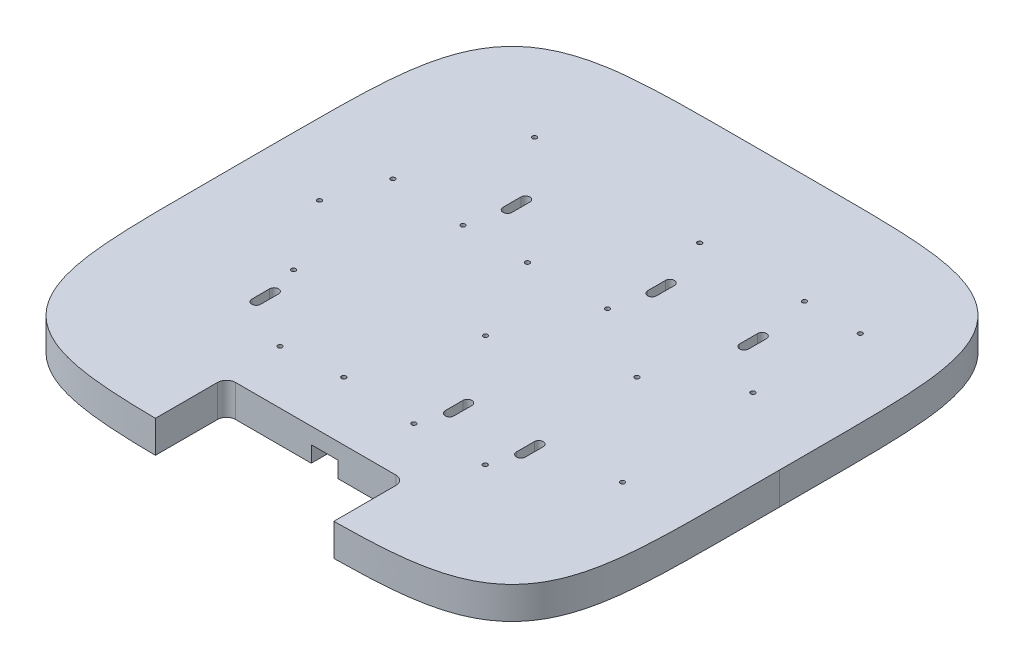
from build123d import *

# Parameters (mm, degrees)
EXTRUDE_1771_DEPTH     = 36
SKETCH_1845_R          = 2.5
CUT_EXTRUDE_1872_DEPTH = 426.788610973
CUT_EXTRUDE_2565_DEPTH = 426.788610973
CUT_EXTRUDE_START      = 18
CUT_EXTRUDE_3162_DEPTH = 18


with BuildPart() as part:
    # Sketch 1764 → Extrude 1771 (new body)
    with BuildSketch(Plane(origin=(0, 0, 0), x_dir=(1, 0, 0), z_dir=(0, 1, 0))):
        with BuildLine():
            Line((-90, -220), (90, -220))
            ThreePointArc((90, -220), (97.071067812, -222.928932188), (100, -230))
            Line((100, -230), (100, -299.752699511))
            add(Edge.make_bspline(
                [(299.999950922, 0), (299.999805192, -8.694402544), (299.999667529, -21.736035588), (300.001217481, -36.951333186), (299.99065116, -54.340218257), (299.962336101, -71.728961342), (299.875758768, -93.46518347), (299.602883242, -117.241979096), (298.679376501, -143.050585558), (297.196692477, -163.287197651), (295.58622598, -177.957343933), (293.488823304, -191.500890473), (291.134108446, -202.858139947), (288.408912089, -213.045142513), (285.410357183, -222.048680325), (282.27571239, -229.881370012), (278.620871904, -237.486995605), (274.403235391, -244.797456487), (269.595972653, -251.736262834), (264.19540074, -258.225391709), (258.225413369, -264.195385619), (251.736290224, -269.595963991), (244.797488667, -274.403233136), (237.487031812, -278.620875987), (229.881409486, -282.275722517), (222.048722342, -285.410372899), (213.045186685, -288.408933496), (202.858185777, -291.134135293), (191.500937546, -293.488855196), (177.957391812, -295.586262487), (163.287246128, -297.196732944), (143.050634387, -298.679420744), (124.850055244, -299.330692316), (110.859628638, -299.611028911), (101.083006334, -299.739273014), (100, -299.752699511)],
                knots=[0, 0, 0, 0, 0, 0.064453125, 0.096679688, 0.112792969, 0.12890625, 0.193359375, 0.2578125, 0.2890625, 0.3203125, 0.34375, 0.3671875, 0.390625, 0.40625, 0.421875, 0.4375, 0.453125, 0.46875, 0.484375, 0.5, 0.515625, 0.53125, 0.546875, 0.5625, 0.578125, 0.59375, 0.609375, 0.6328125, 0.65625, 0.6796875, 0.7109375, 0.7421875, 0.806640625, 0.814669783, 0.814669783, 0.814669783, 0.814669783, 0.814669783], degree=4))
            add(Edge.make_bspline(
                [(299.999950922, 0), (299.999803769, 8.694402544), (299.999663973, 21.736035588), (300.001211436, 36.951333186), (299.99064227, 54.340218255), (299.962324366, 71.728961336), (299.875743478, 93.465183449), (299.602864063, 117.241979031), (298.679353099, 143.050585342), (297.196665764, 163.287197192), (295.586196868, 177.957343211), (293.488791976, 191.500889408), (291.13407526, 202.858138497), (288.408877236, 213.045140617), (285.410320857, 222.048677938), (282.275674783, 229.881367112), (278.620833053, 237.486992108), (274.403195344, 244.7974523), (269.595931471, 251.73625786), (264.195358497, 258.225385851), (258.225370149, 264.195378785), (251.73624612, 269.595956096), (244.797443777, 274.403224105), (237.486986232, 278.620865761), (229.881363308, 282.275711046), (222.048675651, 285.410360147), (213.045139504, 288.40891927), (202.85813815, 291.134119401), (191.500889533, 293.488837446), (177.957343457, 295.586242522), (163.287197509, 297.196710579), (143.050585526, 298.679395068), (117.241979065, 299.602900558), (93.465183554, 299.875773298), (71.728961216, 299.962347549), (54.340218396, 299.990659976), (36.951333084, 300.001223545), (21.73603502, 299.999670958), (8.694402191, 299.999806536), (0, 299.999950922)],
                knots=[0, 0, 0, 0, 0, 0.064453125, 0.096679688, 0.112792969, 0.12890625, 0.193359375, 0.2578125, 0.2890625, 0.3203125, 0.34375, 0.3671875, 0.390625, 0.40625, 0.421875, 0.4375, 0.453125, 0.46875, 0.484375, 0.5, 0.515625, 0.53125, 0.546875, 0.5625, 0.578125, 0.59375, 0.609375, 0.6328125, 0.65625, 0.6796875, 0.7109375, 0.7421875, 0.806640625, 0.87109375, 0.887207031, 0.903320312, 0.935546875, 1, 1, 1, 1, 1], degree=4))
            add(Edge.make_bspline(
                [(-299.999950922, 0), (-299.999803769, 8.694402544), (-299.999663973, 21.736035588), (-300.001211436, 36.951333186), (-299.99064227, 54.340218255), (-299.962324366, 71.728961336), (-299.875743478, 93.465183449), (-299.602864063, 117.241979031), (-298.679353099, 143.050585342), (-297.196665764, 163.287197192), (-295.586196868, 177.957343211), (-293.488791976, 191.500889408), (-291.13407526, 202.858138497), (-288.408877236, 213.045140617), (-285.410320857, 222.048677938), (-282.275674783, 229.881367112), (-278.620833053, 237.486992108), (-274.403195344, 244.7974523), (-269.595931471, 251.73625786), (-264.195358497, 258.225385851), (-258.225370149, 264.195378785), (-251.73624612, 269.595956096), (-244.797443777, 274.403224105), (-237.486986232, 278.620865761), (-229.881363308, 282.275711046), (-222.048675651, 285.410360147), (-213.045139504, 288.40891927), (-202.85813815, 291.134119401), (-191.500889533, 293.488837446), (-177.957343457, 295.586242522), (-163.287197509, 297.196710579), (-143.050585526, 298.679395068), (-117.241979065, 299.602900558), (-93.465183554, 299.875773298), (-71.728961216, 299.962347549), (-54.340218396, 299.990659976), (-36.951333084, 300.001223545), (-21.73603502, 299.999670958), (-8.694402191, 299.999806536), (0, 299.999950922)],
                knots=[0, 0, 0, 0, 0, 0.064453125, 0.096679688, 0.112792969, 0.12890625, 0.193359375, 0.2578125, 0.2890625, 0.3203125, 0.34375, 0.3671875, 0.390625, 0.40625, 0.421875, 0.4375, 0.453125, 0.46875, 0.484375, 0.5, 0.515625, 0.53125, 0.546875, 0.5625, 0.578125, 0.59375, 0.609375, 0.6328125, 0.65625, 0.6796875, 0.7109375, 0.7421875, 0.806640625, 0.87109375, 0.887207031, 0.903320312, 0.935546875, 1, 1, 1, 1, 1], degree=4))
            add(Edge.make_bspline(
                [(-299.999950922, 0), (-299.999805192, -8.694402544), (-299.999667529, -21.736035588), (-300.001217481, -36.951333186), (-299.99065116, -54.340218257), (-299.962336101, -71.728961342), (-299.875758768, -93.46518347), (-299.602883242, -117.241979096), (-298.679376501, -143.050585558), (-297.196692477, -163.287197651), (-295.58622598, -177.957343933), (-293.488823304, -191.500890473), (-291.134108446, -202.858139947), (-288.408912089, -213.045142513), (-285.410357183, -222.048680325), (-282.27571239, -229.881370012), (-278.620871904, -237.486995605), (-274.403235391, -244.797456487), (-269.595972653, -251.736262834), (-264.19540074, -258.225391709), (-258.225413369, -264.195385619), (-251.736290224, -269.595963991), (-244.797488667, -274.403233136), (-237.487031812, -278.620875987), (-229.881409486, -282.275722517), (-222.048722342, -285.410372899), (-213.045186685, -288.408933496), (-202.858185777, -291.134135293), (-191.500937546, -293.488855196), (-177.957391812, -295.586262487), (-163.287246128, -297.196732944), (-143.050634387, -298.679420744), (-124.850055244, -299.330692316), (-110.859628638, -299.611028911), (-101.083006334, -299.739273014), (-100, -299.752699511)],
                knots=[0, 0, 0, 0, 0, 0.064453125, 0.096679688, 0.112792969, 0.12890625, 0.193359375, 0.2578125, 0.2890625, 0.3203125, 0.34375, 0.3671875, 0.390625, 0.40625, 0.421875, 0.4375, 0.453125, 0.46875, 0.484375, 0.5, 0.515625, 0.53125, 0.546875, 0.5625, 0.578125, 0.59375, 0.609375, 0.6328125, 0.65625, 0.6796875, 0.7109375, 0.7421875, 0.806640625, 0.814669783, 0.814669783, 0.814669783, 0.814669783, 0.814669783], degree=4))
            Line((-100, -299.752699511), (-100, -230))
            ThreePointArc((-100, -230), (-97.071067812, -222.928932188), (-90, -220))
        make_face()
    extrude(amount=-EXTRUDE_1771_DEPTH)

    # Sketch 1845 → Cut-Extrude 1872 (cut, through all)
    with BuildSketch(Plane(origin=(0, 0, 0), x_dir=(1, 0, 0), z_dir=(0, 1, 0))):
        with Locations((-115, 60)):
            Circle(SKETCH_1845_R)
        with Locations((47, 60)):
            Circle(SKETCH_1845_R)
        with Locations((210, 60)):
            Circle(SKETCH_1845_R)
        with Locations((-100, -160)):
            Circle(SKETCH_1845_R)
        with Locations((50, -160)):
            Circle(SKETCH_1845_R)
        with Locations((130, -160)):
            Circle(SKETCH_1845_R)
        with Locations((-42.72, 60)):
            Circle(SKETCH_1845_R)
        with Locations((-199.29, 65.75)):
            Circle(SKETCH_1845_R)
        with Locations((-160.19, 185.5)):
            Circle(SKETCH_1845_R)
        with Locations((34.806763, 175.55)):
            Circle(SKETCH_1845_R)
        with Locations((150.216186, 177.55)):
            Circle(SKETCH_1845_R)
        with Locations((212.76, 177.55)):
            Circle(SKETCH_1845_R)
        with Locations((-166.666763, -78.149039)):
            Circle(SKETCH_1845_R)
        with Locations((-219.52, 3.7)):
            Circle(SKETCH_1845_R)
        with Locations((-34.29, -154.25)):
            Circle(SKETCH_1845_R)
        with Locations((4.81, -34.5)):
            Circle(SKETCH_1845_R)
        with Locations((223.895, -100)):
            Circle(SKETCH_1845_R)
        with Locations((130, 10)):
            Circle(SKETCH_1845_R)
    extrude(amount=-CUT_EXTRUDE_1872_DEPTH, mode=Mode.SUBTRACT)

    # Sketch 1912 → Cut-Extrude 2565 (cut, through all)
    with BuildSketch(Plane(origin=(0, 0, 0), x_dir=(1, 0, 0), z_dir=(0, 1, 0))):
        with BuildLine():
            Line((-100, 120), (-100, 100))
            ThreePointArc((-100, 100), (-105, 95), (-110, 100))
            Line((-110, 100), (-110, 120))
            ThreePointArc((-110, 120), (-105, 125), (-100, 120))
        make_face()
        with BuildLine():
            Line((62, 120), (62, 100))
            ThreePointArc((62, 100), (57, 95), (52, 100))
            Line((52, 100), (52, 120))
            ThreePointArc((52, 120), (57, 125), (62, 120))
        make_face()
        with BuildLine():
            Line((165.216186, 120), (165.216186, 100))
            ThreePointArc((165.216186, 100), (160.216186, 95), (155.216186, 100))
            Line((155.216186, 100), (155.216186, 120))
            ThreePointArc((155.216186, 120), (160.216186, 125), (165.216186, 120))
        make_face()
        with BuildLine():
            Line((-151.666763, -110), (-151.666763, -130))
            ThreePointArc((-151.666763, -130), (-156.666763, -135), (-161.666763, -130))
            Line((-161.666763, -130), (-161.666763, -110))
            ThreePointArc((-161.666763, -110), (-156.666763, -105), (-151.666763, -110))
        make_face()
        with BuildLine():
            Line((65, -110), (65, -130))
            ThreePointArc((65, -130), (60, -135), (55, -130))
            Line((55, -130), (55, -110))
            ThreePointArc((55, -110), (60, -105), (65, -110))
        make_face()
        with BuildLine():
            Line((145, -110), (145, -130))
            ThreePointArc((145, -130), (140, -135), (135, -130))
            Line((135, -130), (135, -110))
            ThreePointArc((135, -110), (140, -105), (145, -110))
        make_face()
    extrude(amount=-CUT_EXTRUDE_2565_DEPTH, mode=Mode.SUBTRACT)

    # Sketch 2623 → Cut-Extrude 3162 (cut)
    with BuildSketch(Plane(origin=(0, -36, 0), x_dir=(1, 0, 0), z_dir=(0, 1, 0)).offset(CUT_EXTRUDE_START)):
        with BuildLine():
            Line((-105, 95), (70, 95))
            ThreePointArc((70, 95), (73.535533906, 93.535533906), (75, 90))
            Line((75, 90), (75, -100))
            ThreePointArc((75, -100), (73.535533906, -103.535533906), (70, -105))
            Line((70, -105), (-156.666763, -105))
            ThreePointArc((-156.666763, -105), (-160.202296906, -106.464466094), (-161.666763, -110))
            Line((-161.666763, -110), (-161.666763, -130))
            ThreePointArc((-161.666763, -130), (-160.202296906, -133.535533906), (-156.666763, -135))
            Line((-156.666763, -135), (-10, -135))
            ThreePointArc((-10, -135), (-6.464466094, -136.464466094), (-5, -140))
            Line((-5, -140), (-5, -220))
            Line((-5, -220), (25, -220))
            Line((25, -220), (25, -140))
            ThreePointArc((25, -140), (26.464466094, -136.464466094), (30, -135))
            Line((30, -135), (140, -135))
            ThreePointArc((140, -135), (143.535533906, -133.535533906), (145, -130))
            Line((145, -130), (145, -110))
            ThreePointArc((145, -110), (143.535533906, -106.464466094), (140, -105))
            Line((140, -105), (110, -105))
            ThreePointArc((110, -105), (106.464466094, -103.535533906), (105, -100))
            Line((105, -100), (105, 90))
            ThreePointArc((105, 90), (106.464466094, 93.535533906), (110, 95))
            Line((110, 95), (160.216186, 95))
            ThreePointArc((160.216186, 95), (163.751719906, 96.464466094), (165.216186, 100))
            Line((165.216186, 100), (165.216186, 120))
            ThreePointArc((165.216186, 120), (163.751719906, 123.535533906), (160.216186, 125))
            Line((160.216186, 125), (-105, 125))
            ThreePointArc((-105, 125), (-108.535533906, 123.535533906), (-110, 120))
            Line((-110, 120), (-110, 100))
            ThreePointArc((-110, 100), (-108.535533906, 96.464466094), (-105, 95))
        make_face()
    extrude(amount=-CUT_EXTRUDE_3162_DEPTH, mode=Mode.SUBTRACT)


solid = part.part
